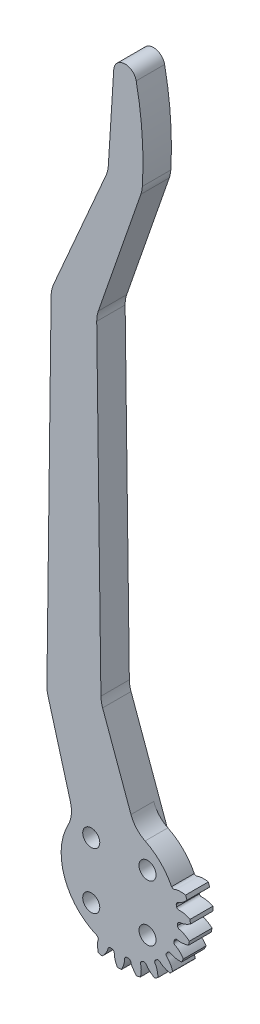
from build123d import *

# Parameters (mm, degrees)
SKETCH_1_R               = 12.5
EXTRUDE_1_DEPTH          = 4
CUT_EXTRUDE_1_DEPTH      = 19.12456896
PATTERN_CIRCULAR_1_COUNT = 23
EXTRUDE_2_DEPTH          = 5
CUT_EXTRUDE_START        = -10
CUT_EXTRUDE_2_DEPTH      = 10
FILLET_START             = -2
FILLET_1_DEPTH           = 7
FILLET_1_2_DEPTH         = 4
FILLET_START_2           = -1
FILLET_1_3_DEPTH         = 1.42248
SKETCH_6_R               = 1.5
CUT_EXTRUDE_3_DEPTH      = 10


with BuildPart() as part:
    # 草图1 → 凸台-拉伸1 (new body)
    with BuildSketch(Plane.XY):
        Circle(SKETCH_1_R)
    extrude(amount=EXTRUDE_1_DEPTH)

    # 草图2 → 切除-拉伸1 (cut, through all)
    with BuildSketch(Plane.XY):
        with BuildLine():
            ThreePointArc((0.181377653, 10.248395101), (0, 10.25), (-0.181377653, 10.248395101))
            add(Edge.make_bspline(
                [(-0.181377653, 10.248395101), (-0.577733486, 10.366762974), (-0.543760308, 10.63383717), (-0.592929934, 10.897175969), (-0.599497923, 10.928924648), (-0.607662079, 10.964750021), (-0.617581589, 11.004600593), (-0.629422247, 11.048418382), (-0.643345631, 11.096140951), (-0.659512363, 11.147700822), (-0.678080917, 11.203025719), (-0.699207817, 11.262038556), (-0.723047409, 11.324657509), (-0.749751766, 11.390796064), (-0.77947055, 11.460363083), (-0.812350892, 11.53326286), (-0.848537271, 11.609395193), (-0.888171388, 11.688655445), (-0.931392054, 11.77093462), (-0.978335067, 11.85611944), (-1.029133098, 11.944092416), (-1.083915577, 12.034731933), (-1.142808585, 12.127912332), (-1.205934738, 12.223503996), (-1.273413083, 12.321373437), (-1.345358995, 12.421383392), (-1.42188407, 12.523392912), (-1.503096023, 12.627257463), (-1.589098596, 12.732829022), (-1.679991457, 12.839956181), (-1.775870106, 12.94848425), (-1.876825788, 13.058255364), (-1.982945401, 13.169108593), (-2.094311412, 13.28088005), (-2.211001774, 13.393403009), (-2.333089845, 13.506508017), (-2.460644312, 13.620023012), (-2.59372912, 13.733773443), (-2.732403367, 13.847582394), (-2.927091206, 14.000950144), (-3.078290454, 14.112796156), (-3.181680766, 14.186195552)],
                knots=[0, 0, 0, 0, 0.147386897, 0.152959532, 0.159389495, 0.166676786, 0.174821406, 0.183823355, 0.193682632, 0.204399237, 0.21597317, 0.228404432, 0.241693023, 0.255838942, 0.270842189, 0.286702764, 0.303420668, 0.320995901, 0.339428462, 0.358718351, 0.378865568, 0.399870114, 0.421731989, 0.444451192, 0.468027723, 0.492461582, 0.517752771, 0.543901287, 0.570907132, 0.598770305, 0.627490807, 0.657068637, 0.687503795, 0.718796282, 0.750946098, 0.783953241, 0.817817713, 0.852539514, 0.888118643, 0.9245551, 1, 1, 1, 1], degree=3))
            ThreePointArc((-3.181680766, 14.186195552), (0, 14.538611926), (3.181680766, 14.186195552))
            add(Edge.make_bspline(
                [(0.181377653, 10.248395101), (0.577733486, 10.366762974), (0.543760308, 10.63383717), (0.592929934, 10.897175969), (0.599497923, 10.928924648), (0.607662079, 10.964750021), (0.617581589, 11.004600593), (0.629422247, 11.048418382), (0.643345631, 11.096140951), (0.659512363, 11.147700822), (0.678080917, 11.203025719), (0.699207817, 11.262038556), (0.723047409, 11.324657509), (0.749751766, 11.390796064), (0.77947055, 11.460363083), (0.812350892, 11.53326286), (0.848537271, 11.609395193), (0.888171388, 11.688655445), (0.931392054, 11.77093462), (0.978335067, 11.85611944), (1.029133098, 11.944092416), (1.083915577, 12.034731933), (1.142808585, 12.127912332), (1.205934738, 12.223503996), (1.273413083, 12.321373437), (1.345358995, 12.421383392), (1.42188407, 12.523392912), (1.503096023, 12.627257463), (1.589098596, 12.732829022), (1.679991457, 12.839956181), (1.775870106, 12.94848425), (1.876825788, 13.058255364), (1.982945401, 13.169108593), (2.094311412, 13.28088005), (2.211001774, 13.393403009), (2.333089845, 13.506508017), (2.460644312, 13.620023012), (2.59372912, 13.733773443), (2.732403367, 13.847582394), (2.927091206, 14.000950144), (3.078290454, 14.112796156), (3.181680766, 14.186195552)],
                knots=[0, 0, 0, 0, 0.147386897, 0.152959532, 0.159389495, 0.166676786, 0.174821406, 0.183823355, 0.193682632, 0.204399237, 0.21597317, 0.228404432, 0.241693023, 0.255838942, 0.270842189, 0.286702764, 0.303420668, 0.320995901, 0.339428462, 0.358718351, 0.378865568, 0.399870114, 0.421731989, 0.444451192, 0.468027723, 0.492461582, 0.517752771, 0.543901287, 0.570907132, 0.598770305, 0.627490807, 0.657068637, 0.687503795, 0.718796282, 0.750946098, 0.783953241, 0.817817713, 0.852539514, 0.888118643, 0.9245551, 1, 1, 1, 1], degree=3))
        make_face()
    cut_extrude_1 = extrude(amount=CUT_EXTRUDE_1_DEPTH, mode=Mode.SUBTRACT)

    # 阵列(圆周)1: 切除-拉伸1 ×23 about axis
    pattern_circular_1_axis = Axis((0, 0, 4), (0, 0, -1))
    for i in range(1, PATTERN_CIRCULAR_1_COUNT):
        add(cut_extrude_1.rotate(pattern_circular_1_axis, i * 360 / PATTERN_CIRCULAR_1_COUNT), mode=Mode.SUBTRACT)

    # 草图4 → 凸台-拉伸2 (add)
    with BuildSketch(Plane.XY.offset(4)):
        with BuildLine():
            Line((-4, 85), (4, 108))
            ThreePointArc((4, 108), (4.033223384, 116.155551726), (2.960143453, 124.24026738))
            ThreePointArc((2.960143453, 124.24026738), (0.862921027, 125.838276327), (-0.996059018, 123.968472141))
            Line((-0.996059018, 123.968472141), (-2, 108))
            Line((-2, 108), (-12, 85))
            Line((-12, 85), (-12.762120736, 23.476121364))
            Line((-12.762120736, 23.476121364), (-5.780286897, -1.608814279))
            ThreePointArc((-5.780286897, -1.608814279), (1.828654363, -5.714544883), (5.640445081, 2.045819954))
            Line((5.640445081, 2.045819954), (-3.237879264, 26.523878636))
            Line((-3.237879264, 26.523878636), (-4, 85))
        make_face()
    extrude(amount=-EXTRUDE_2_DEPTH)

    # 草图5 → 切除-拉伸2 (cut)
    with BuildSketch(Plane.XY.offset(4).offset(CUT_EXTRUDE_START)):
        with BuildLine():
            Line((-4.083611171, -9.40141584), (-5.976016348, -13.758169523))
            ThreePointArc((-5.976016348, -13.758169523), (-14.8602695, -2.042642993), (-9.466543504, 11.635486843))
            Line((-9.466543504, 11.635486843), (-8.008597925, 6.397254042))
            ThreePointArc((-8.008597925, 6.397254042), (-9.947606381, -2.471361423), (-4.083611171, -9.40141584))
        make_face()
        with BuildLine():
            Line((9.182844039, 4.553885742), (13.43830835, 6.664223037))
            ThreePointArc((13.43830835, 6.664223037), (8.30793868, 12.489121462), (0.952882683, 14.969703223))
            Line((0.952882683, 14.969703223), (2.806853148, 9.858198385))
            ThreePointArc((2.806853148, 9.858198385), (6.55531409, 7.879743472), (9.182844039, 4.553885742))
        make_face()
    extrude(amount=CUT_EXTRUDE_2_DEPTH, mode=Mode.SUBTRACT)

    # 圆角1: read off the stored shape, not the designer's step
    # 圆角1 outline → 圆角1 (cut)
    with BuildSketch(Plane.XY.offset(FILLET_START)):
        with BuildLine():
            ThreePointArc((-12.570561016, 22.787869057), (-12.711765408, 23.482680886), (-12.753271693, 24.190479859))
            Line((-12.753271693, 24.190479859), (-12.762120736, 23.476121364))
            Line((-12.762120736, 23.476121364), (-12.570561016, 22.787869057))
        make_face()
        with BuildLine():
            ThreePointArc((-12.012481462, 83.992406447), (-11.901705522, 84.978920065), (-11.598215318, 85.924104769))
            Line((-11.598215318, 85.924104769), (-12, 85))
            Line((-12, 85), (-12.012481462, 83.992406447))
        make_face()
        with BuildLine():
            ThreePointArc((4.04665086, 108.703516046), (3.95851391, 108.023748182), (3.778233928, 107.362422544))
            Line((3.778233928, 107.362422544), (4, 108))
            ThreePointArc((4, 108), (4.024358818, 108.351689498), (4.04665086, 108.703516046))
        make_face()
    extrude(amount=FILLET_1_DEPTH, mode=Mode.SUBTRACT)

    # Fillet 1 2 outline → Fillet 1 2 (add)
    with BuildSketch(Plane.XY):
        with BuildLine():
            Line((-2, 108), (-1.944959799, 108.875457759))
            ThreePointArc((-1.944959799, 108.875457759), (-2.074237584, 108.017888677), (-2.349757061, 107.195558759))
            Line((-2.349757061, 107.195558759), (-2, 108))
        make_face()
        with BuildLine():
            Line((-8.008597925, 6.397254042), (-8.612420786, 8.566720971))
            ThreePointArc((-8.612420786, 8.566720971), (-8.460149402, 6.671715216), (-9.026268654, 4.856848174))
            ThreePointArc((-9.026268654, 4.856848174), (-8.552185826, 5.650010407), (-8.008597925, 6.397254042))
        make_face()
        with BuildLine():
            ThreePointArc((4.529749558, 9.194774002), (3.015178125, 10.343820025), (2.039012587, 11.975179651))
            Line((2.039012587, 11.975179651), (2.806853148, 9.858198385))
            ThreePointArc((2.806853148, 9.858198385), (3.683268629, 9.565355832), (4.529749558, 9.194774002))
        make_face()
        with BuildLine():
            ThreePointArc((-2.949689414, 25.729322391), (-3.168097398, 26.536612167), (-3.248893918, 27.369012763))
            Line((-3.248893918, 27.369012763), (-3.237879264, 26.523878636))
            Line((-3.237879264, 26.523878636), (-2.949689414, 25.729322391))
        make_face()
        with BuildLine():
            ThreePointArc((-3.988554162, 84.121781906), (-3.924434467, 84.987739186), (-3.711462741, 85.829544621))
            Line((-3.711462741, 85.829544621), (-4, 85))
            Line((-4, 85), (-3.988554162, 84.121781906))
        make_face()
    extrude(amount=FILLET_1_2_DEPTH)

    # Fillet 1 3 outline → Fillet 1 3 (add)
    with BuildSketch(Plane.XY.offset(FILLET_START_2)):
        with BuildLine():
            Line((-2, 108), (-1.944959799, 108.875457759))
            ThreePointArc((-1.944959799, 108.875457759), (-2.074237584, 108.017888677), (-2.349757061, 107.195558759))
            Line((-2.349757061, 107.195558759), (-2, 108))
        make_face()
        with BuildLine():
            ThreePointArc((-2.949689414, 25.729322391), (-3.168097398, 26.536612167), (-3.248893918, 27.369012763))
            Line((-3.248893918, 27.369012763), (-3.237879264, 26.523878636))
            Line((-3.237879264, 26.523878636), (-2.949689414, 25.729322391))
        make_face()
        with BuildLine():
            ThreePointArc((-3.988554162, 84.121781906), (-3.924434467, 84.987739186), (-3.711462741, 85.829544621))
            Line((-3.711462741, 85.829544621), (-4, 85))
            Line((-4, 85), (-3.988554162, 84.121781906))
        make_face()
    extrude(amount=FILLET_1_3_DEPTH)

    # 草图6 → 切除-拉伸3 (cut)
    with BuildSketch(Plane.XY.offset(4)):
        with Locations((4.949747468, 4.949747468)):
            Circle(SKETCH_6_R)
        with Locations((4.949747468, -4.949747468)):
            Circle(SKETCH_6_R)
        with Locations((-4.949747468, -4.949747468)):
            Circle(SKETCH_6_R)
        with Locations((-4.949747468, 4.949747468)):
            Circle(SKETCH_6_R)
    extrude(amount=-CUT_EXTRUDE_3_DEPTH, mode=Mode.SUBTRACT)


solid = part.part
